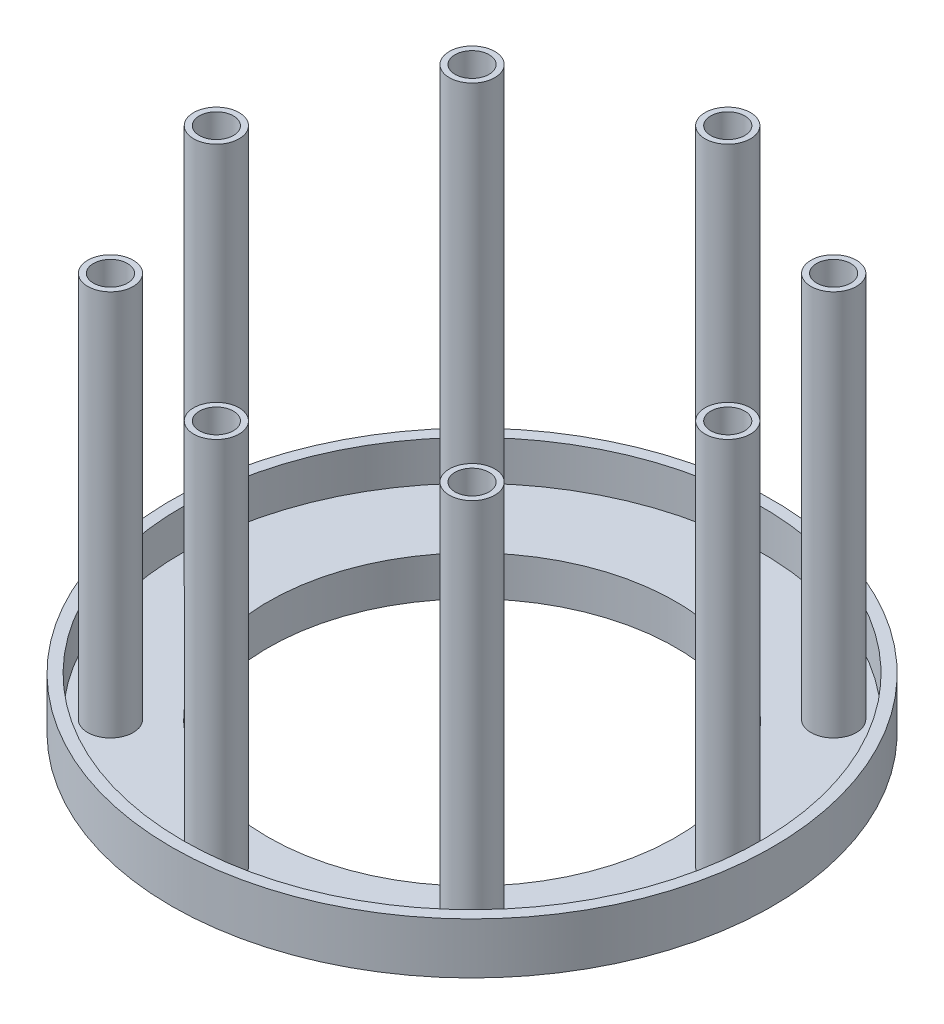
from build123d import *

# Parameters (mm, degrees)
IZIM3_R                        = 4
KES_EKSTR_ZYON1_DEPTH          = 10
PAH1_SIZE                      = 0.5
IZIM4_R                        = 4
IZIM4_R_2                      = 3
Y_KSEKLIK_EKSTR_ZYON5_DEPTH    = 70
DAIRESEL_START                 = 2.606299213
DAIRESEL_KAPLAMA15_OUTLINE_R   = 4
DAIRESEL_KAPLAMA15_OUTLINE_R_2 = 3
DAIRESEL_KAPLAMA15_DEPTH       = 68
DAIRESEL_START_2               = 0.606299213
DAIRESEL_KAPLAMA15_2_OUTLINE_R = 3
DAIRESEL_KAPLAMA15_2_DEPTH     = 2


# Read off the part's stored shape, not the designer's step: Dairesel Kaplama15
with BuildPart() as part:
    # Çizim1 → Döndür2 (revolve)
    with BuildSketch(Plane.XY, mode=Mode.PRIVATE) as d_nd_r2_sk:
        Polygon((-52.9, 9.606299213), (-52.9, 0.606299213), (-37.9, 0.606299213), (-37.9, -4.393700787), (-35.9, -4.393700787), (-35.9, 2.606299213), (-50.9, 2.606299213), (-50.9, 9.606299213), align=None)
    revolve(d_nd_r2_sk.sketch.rotate(Axis((0, 16.98519685, 0), (0, -1, 0)), 270), axis=Axis((0, 16.98519685, 0), (0, -1, 0)))

    # Çizim3 → Kes-Ekstrüzyon1 (cut)
    with BuildSketch(Plane.XZ.offset(-0.606299213)):
        with Locations(Location((0, 45, 0), (0, 0, 270))):
            Circle(IZIM3_R)
    extrude(amount=-KES_EKSTR_ZYON1_DEPTH, mode=Mode.SUBTRACT)

    # Pah1
    pah1_edges = [part.edges().sort_by_distance(p)[0] for p in [
        (0, 0.606299213, 49),
    ]]
    chamfer(pah1_edges, length=PAH1_SIZE)

    # Çizim4 → Yükseklik-Ekstrüzyon5 (add)
    with BuildSketch(Plane.XZ.offset(-0.606299213)):
        with Locations(Location((0, 45, 0), (0, 0, 270))):
            Circle(IZIM4_R)
        with Locations(Location((0, 45, 0), (0, 0, 270))):
            Circle(IZIM4_R_2, mode=Mode.SUBTRACT)
    extrude(amount=-Y_KSEKLIK_EKSTR_ZYON5_DEPTH)

    # Dairesel Kaplama15 outline → Dairesel Kaplama15 (add)
    # profile 1 of 7: a face of its own
    with BuildSketch(Plane(origin=(0, 0, 0), x_dir=(1, 0, 0), z_dir=(0, 1, 0)).offset(DAIRESEL_START)):
        with Locations((31.819805153, -31.819805153)):
            Circle(DAIRESEL_KAPLAMA15_OUTLINE_R)
        with Locations((31.819805153, -31.819805153)):
            Circle(DAIRESEL_KAPLAMA15_OUTLINE_R_2, mode=Mode.SUBTRACT)
    # profile 2 of 7: a face of its own
    with BuildSketch(Plane(origin=(0, 0, 0), x_dir=(1, 0, 0), z_dir=(0, 1, 0)).offset(DAIRESEL_START)):
        with Locations((45, 0)):
            Circle(DAIRESEL_KAPLAMA15_OUTLINE_R)
        with Locations((45, 0)):
            Circle(DAIRESEL_KAPLAMA15_OUTLINE_R_2, mode=Mode.SUBTRACT)
    # profile 3 of 7: a face of its own
    with BuildSketch(Plane(origin=(0, 0, 0), x_dir=(1, 0, 0), z_dir=(0, 1, 0)).offset(DAIRESEL_START)):
        with Locations((31.819805153, 31.819805153)):
            Circle(DAIRESEL_KAPLAMA15_OUTLINE_R)
        with Locations((31.819805153, 31.819805153)):
            Circle(DAIRESEL_KAPLAMA15_OUTLINE_R_2, mode=Mode.SUBTRACT)
    # profile 4 of 7: a face of its own
    with BuildSketch(Plane(origin=(0, 0, 0), x_dir=(1, 0, 0), z_dir=(0, 1, 0)).offset(DAIRESEL_START)):
        with Locations((0, 45)):
            Circle(DAIRESEL_KAPLAMA15_OUTLINE_R)
        with Locations((0, 45)):
            Circle(DAIRESEL_KAPLAMA15_OUTLINE_R_2, mode=Mode.SUBTRACT)
    # profile 5 of 7: a face of its own
    with BuildSketch(Plane(origin=(0, 0, 0), x_dir=(1, 0, 0), z_dir=(0, 1, 0)).offset(DAIRESEL_START)):
        with Locations((-31.819805153, 31.819805153)):
            Circle(DAIRESEL_KAPLAMA15_OUTLINE_R)
        with Locations((-31.819805153, 31.819805153)):
            Circle(DAIRESEL_KAPLAMA15_OUTLINE_R_2, mode=Mode.SUBTRACT)
    # profile 6 of 7: a face of its own
    with BuildSketch(Plane(origin=(0, 0, 0), x_dir=(1, 0, 0), z_dir=(0, 1, 0)).offset(DAIRESEL_START)):
        with Locations((-45, 0)):
            Circle(DAIRESEL_KAPLAMA15_OUTLINE_R)
        with Locations((-45, 0)):
            Circle(DAIRESEL_KAPLAMA15_OUTLINE_R_2, mode=Mode.SUBTRACT)
    # profile 7 of 7: a face of its own
    with BuildSketch(Plane(origin=(0, 0, 0), x_dir=(1, 0, 0), z_dir=(0, 1, 0)).offset(DAIRESEL_START)):
        with Locations((-31.819805153, -31.819805153)):
            Circle(DAIRESEL_KAPLAMA15_OUTLINE_R)
        with Locations((-31.819805153, -31.819805153)):
            Circle(DAIRESEL_KAPLAMA15_OUTLINE_R_2, mode=Mode.SUBTRACT)
    extrude(amount=DAIRESEL_KAPLAMA15_DEPTH)

    # Dairesel Kaplama15 2 outline → Dairesel Kaplama15 2 (cut)
    with BuildSketch(Plane(origin=(0, 0, 0), x_dir=(1, 0, 0), z_dir=(0, 1, 0)).offset(DAIRESEL_START_2)):
        with Locations((31.819805153, -31.819805153)):
            Circle(DAIRESEL_KAPLAMA15_2_OUTLINE_R)
        with Locations((45, 0)):
            Circle(DAIRESEL_KAPLAMA15_2_OUTLINE_R)
        with Locations((31.819805153, 31.819805153)):
            Circle(DAIRESEL_KAPLAMA15_2_OUTLINE_R)
        with Locations((0, 45)):
            Circle(DAIRESEL_KAPLAMA15_2_OUTLINE_R)
        with Locations((-31.819805153, 31.819805153)):
            Circle(DAIRESEL_KAPLAMA15_2_OUTLINE_R)
        with Locations((-45, 0)):
            Circle(DAIRESEL_KAPLAMA15_2_OUTLINE_R)
        with Locations((-31.819805153, -31.819805153)):
            Circle(DAIRESEL_KAPLAMA15_2_OUTLINE_R)
    extrude(amount=DAIRESEL_KAPLAMA15_2_DEPTH, mode=Mode.SUBTRACT)

    # Dairesel Kaplama15 3 outline → Dairesel Kaplama15 3 (revolve, cut)
    with BuildSketch(Plane(origin=(31.819805153, 0, 31.819805153), x_dir=(1, 0, 0), z_dir=(0, 0, 1))):
        Polygon((4.5, 0.606299213), (4, 1.106299213), (4, 0.606299213), align=None)
    revolve(axis=Axis((31.819805153, 0, 31.819805153), (0, 1, 0)), mode=Mode.SUBTRACT)

    # Dairesel Kaplama15 4 outline → Dairesel Kaplama15 4 (revolve, cut)
    with BuildSketch(Plane(origin=(45, 0, 0), x_dir=(1, 0, 0), z_dir=(0, 0, 1))):
        Polygon((4.5, 0.606299213), (4, 1.106299213), (4, 0.606299213), align=None)
    revolve(axis=Axis((45, 0, 0), (0, 1, 0)), mode=Mode.SUBTRACT)

    # Dairesel Kaplama15 5 outline → Dairesel Kaplama15 5 (revolve, cut)
    with BuildSketch(Plane(origin=(31.819805153, 0, -31.819805153), x_dir=(1, 0, 0), z_dir=(0, 0, 1))):
        Polygon((4.5, 0.606299213), (4, 1.106299213), (4, 0.606299213), align=None)
    revolve(axis=Axis((31.819805153, 0, -31.819805153), (0, 1, 0)), mode=Mode.SUBTRACT)

    # Dairesel Kaplama15 6 outline → Dairesel Kaplama15 6 (revolve, cut)
    with BuildSketch(Plane.XY.offset(-45)):
        Polygon((4.5, 0.606299213), (4, 1.106299213), (4, 0.606299213), align=None)
    revolve(axis=Axis((0, 0, -45), (0, 1, 0)), mode=Mode.SUBTRACT)

    # Dairesel Kaplama15 7 outline → Dairesel Kaplama15 7 (revolve, cut)
    with BuildSketch(Plane(origin=(-31.819805153, 0, -31.819805153), x_dir=(1, 0, 0), z_dir=(0, 0, 1))):
        Polygon((4.5, 0.606299213), (4, 1.106299213), (4, 0.606299213), align=None)
    revolve(axis=Axis((-31.819805153, 0, -31.819805153), (0, 1, 0)), mode=Mode.SUBTRACT)

    # Dairesel Kaplama15 8 outline → Dairesel Kaplama15 8 (revolve, cut)
    with BuildSketch(Plane(origin=(-45, 0, 0), x_dir=(1, 0, 0), z_dir=(0, 0, 1))):
        Polygon((4.5, 0.606299213), (4, 1.106299213), (4, 0.606299213), align=None)
    revolve(axis=Axis((-45, 0, 0), (0, 1, 0)), mode=Mode.SUBTRACT)

    # Dairesel Kaplama15 9 outline → Dairesel Kaplama15 9 (revolve, cut)
    with BuildSketch(Plane(origin=(-31.819805153, 0, 31.819805153), x_dir=(1, 0, 0), z_dir=(0, 0, 1))):
        Polygon((4.5, 0.606299213), (4, 1.106299213), (4, 0.606299213), align=None)
    revolve(axis=Axis((-31.819805153, 0, 31.819805153), (0, 1, 0)), mode=Mode.SUBTRACT)


solid = part.part
